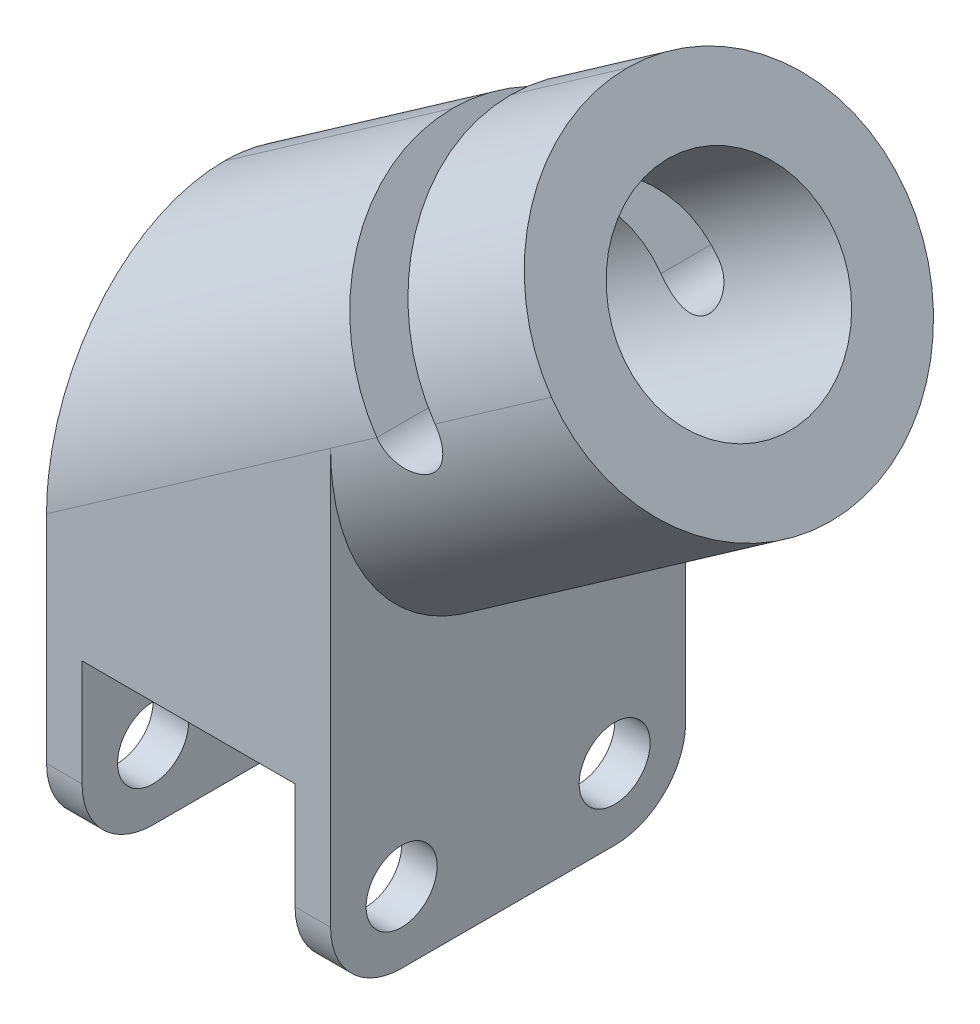
from build123d import *

# Parameters (mm, degrees)
BOSS_EXTRUDE1_DEPTH     = 50
SKETCH2_R               = 15
CUT_EXTRUDE1_DEPTH      = 60
CHAMFER1_SIZE           = 5
CUT_EXTRUDE2_DEPTH      = 128.713132763
CUT_EXTRUDE2_DEPTH_BACK = 128.713132763
SKETCH3_R               = 5
FILLET2_R               = 10
FILLET3_R               = 25


with BuildPart() as part:
    # Sketch1 → Boss-Extrude1 (new body)
    with BuildSketch(Plane.XY):
        with BuildLine():
            Line((5, -25), (5, 0))
            Line((5, 0), (35, 0))
            Line((35, 0), (35, -25))
            Line((35, -25), (40, -25))
            Line((40, -25), (40, 0))
            Line((40, 0), (40, 12.914909334))
            Line((40, 12.914909334), (85.43033171, 44.72557006))
            Line((85.43033171, 44.72557006), (56.751509892, 85.683172275))
            Line((56.751509892, 85.683172275), (40.368469006, 74.211643548))
            Line((40.368469006, 74.211643548), (54.707879915, 53.732842441))
            ThreePointArc((54.707879915, 53.732842441), (53.480001875, 46.769200037), (46.516359472, 47.997078077))
            Line((46.516359472, 47.997078077), (32.176948563, 68.475879184))
            Line((32.176948563, 68.475879184), (0, 45.945337244))
            Line((0, 45.945337244), (0, 0))
            Line((0, 0), (0, -25))
            Line((0, -25), (5, -25))
        make_face()
    extrude(amount=BOSS_EXTRUDE1_DEPTH)

    # Sketch2 → Cut-Extrude1 (cut)
    with BuildSketch(Plane(origin=(78.338757076, 54.853388238, 0), x_dir=(0, 0, -1), z_dir=(0.8191520442889928, 0.5735764363510449, 0))):
        with Locations(Location((-25, 12.636216929, 0), (0, 0, 90))):
            Circle(SKETCH2_R)
    extrude(amount=-CUT_EXTRUDE1_DEPTH, mode=Mode.SUBTRACT)

    # Chamfer1
    chamfer1_edges = [part.edges().sort_by_distance(p)[0] for p in [
        (30.545444689, 18.502504322, 25),
    ]]
    chamfer(chamfer1_edges, length=CHAMFER1_SIZE)

    # Sketch3 → Cut-Extrude2 (cut, two sides: drawn at the far end of the back side and taken through both)
    with BuildSketch(Plane(origin=(5, 0, 0), x_dir=(0, 0, -1), z_dir=(1, 0, 0)).offset(-CUT_EXTRUDE2_DEPTH_BACK)):
        with Locations((-40, -15)):
            Circle(SKETCH3_R)
        with Locations((-10, -15)):
            Circle(SKETCH3_R)
    extrude(amount=CUT_EXTRUDE2_DEPTH + CUT_EXTRUDE2_DEPTH_BACK, mode=Mode.SUBTRACT)

    # Fillet2
    fillet2_edges = [part.edges().sort_by_distance(p)[0] for p in [
        (37.5, -25, 0),
        (2.5, -25, 0),
        (2.5, -25, 50),
        (37.5, -25, 50),
    ]]
    fillet(fillet2_edges, radius=FILLET2_R)

    # Fillet3
    # the kernel refuses this fillet: 25 mm, written as the material it takes off along each edge
    with BuildSketch(Plane(origin=(83.373951331, 104.324406456, 0), x_dir=(0.5735764363510446, -0.8191520442889929, 0), z_dir=(-0.8191520442889929, -0.5735764363510447, 0)), Plane(origin=(83.373951331, 104.324406456, 50), x_dir=(0, 0, -1), z_dir=(-0.8191520442889929, -0.5735764363510447, 0))) as fillet3_piece_1:
        with BuildLine():
            CenterArc((FILLET3_R, FILLET3_R), FILLET3_R, 180, 90)
            Line((0, FILLET3_R), (0, 0))
            Line((0, 0), (FILLET3_R, 0))
        make_face()
    extrude(amount=164.28080115, mode=Mode.SUBTRACT)
    with BuildSketch(Plane(origin=(107.94851266, 121.531699547, 0), x_dir=(0.573576436351046, -0.8191520442889918, 0), z_dir=(-0.8191520442889919, -0.5735764363510462, 0)), Plane(origin=(107.94851266, 121.531699547, 50), x_dir=(0, 0, -1), z_dir=(-0.8191520442889919, -0.5735764363510462, 0))) as fillet3_piece_2:
        with BuildLine():
            CenterArc((FILLET3_R, FILLET3_R), FILLET3_R, 180, 90)
            Line((0, FILLET3_R), (0, 0))
            Line((0, 0), (FILLET3_R, 0))
        make_face()
    extrude(amount=145, mode=Mode.SUBTRACT)
    with BuildSketch(Plane(origin=(-11.197002768, -22.933617938, 0), x_dir=(-0.5735764363510454, 0.8191520442889921, 0), z_dir=(0.8191520442889924, 0.5735764363510455, 0))) as fillet3_piece_3_section:
        with BuildLine():
            CenterArc((FILLET3_R, FILLET3_R), FILLET3_R, 180, 90)
            Line((0, FILLET3_R), (0, 0))
            Line((0, 0), (FILLET3_R, 0))
        make_face()
    fillet3_piece_3 = extrude(amount=180.46019451, mode=Mode.PRIVATE)
    fillet3_piece_3 = split(fillet3_piece_3, bisect_by=Plane(origin=(40, 25.184030637, 6.00422592), z_dir=(1, 0, 0)), keep=Keep.TOP, mode=Mode.PRIVATE)
    add(fillet3_piece_3, mode=Mode.SUBTRACT)
    with BuildSketch(Plane(origin=(-11.197002768, -22.933617938, 50), x_dir=(0, 0, -1), z_dir=(0.8191520442889924, 0.5735764363510455, 0))) as fillet3_piece_4_section:
        with BuildLine():
            CenterArc((FILLET3_R, FILLET3_R), FILLET3_R, 180, 90)
            Line((0, FILLET3_R), (0, 0))
            Line((0, 0), (FILLET3_R, 0))
        make_face()
    fillet3_piece_4 = extrude(amount=180.46019451, mode=Mode.PRIVATE)
    fillet3_piece_4 = split(fillet3_piece_4, bisect_by=Plane(origin=(40, 25.184030637, 43.99577408), z_dir=(1, 0, 0)), keep=Keep.TOP, mode=Mode.PRIVATE)
    add(fillet3_piece_4, mode=Mode.SUBTRACT)


solid = part.part
